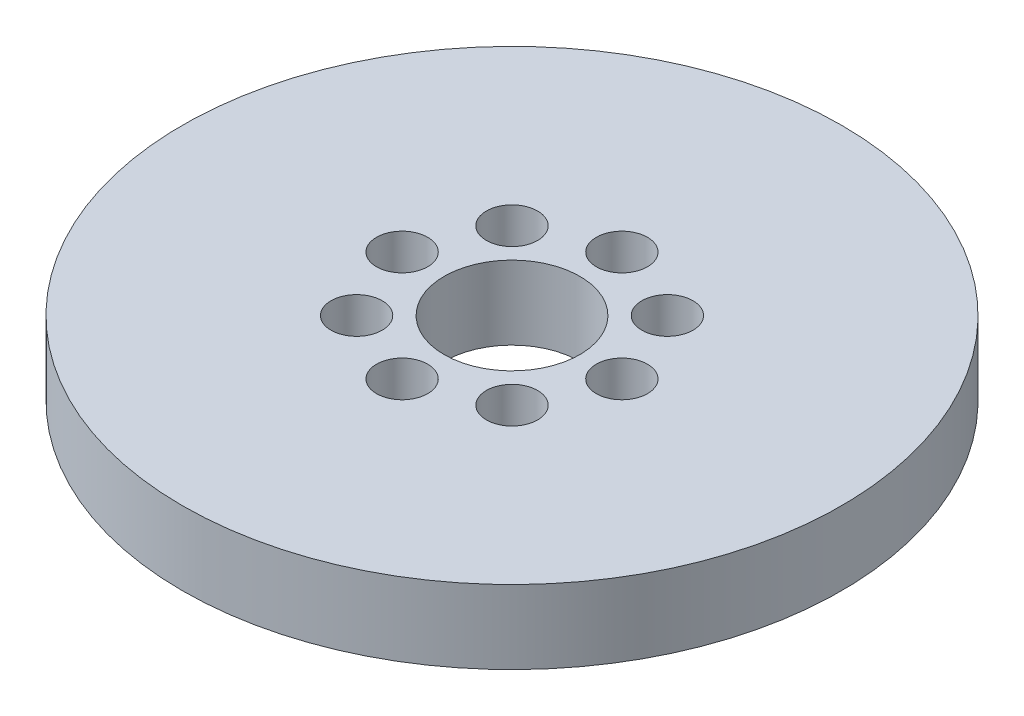
from build123d import *

# Parameters (mm, degrees)
SKETCH1_R           = 85
BOSS_EXTRUDE1_DEPTH = 19
SKETCH2_R           = 17.5
CUT_EXTRUDE1_DEPTH  = 122.70045193
SKETCH3_R           = 6.600383074
CUT_EXTRUDE2_DEPTH  = 12.705151312
CIRPATTERN1_COUNT   = 8


with BuildPart() as part:
    # Sketch1 → Boss-Extrude1 (new body)
    with BuildSketch(Plane(origin=(0, 0, 0), x_dir=(1, 0, 0), z_dir=(0, 1, 0))):
        Circle(SKETCH1_R)
    extrude(amount=BOSS_EXTRUDE1_DEPTH)

    # Sketch2 → Cut-Extrude1 (cut, through all)
    with BuildSketch(Plane(origin=(0, 0, 0), x_dir=(1, 0, 0), z_dir=(0, 1, 0))):
        Circle(SKETCH2_R)
    extrude(amount=CUT_EXTRUDE1_DEPTH, mode=Mode.SUBTRACT)

    # Sketch3 → Cut-Extrude2 (cut)
    with BuildSketch(Plane(origin=(0, 19, 0), x_dir=(1, 0, 0), z_dir=(0, 1, 0))):
        with Locations((-28.342478597, 0)):
            Circle(SKETCH3_R)
    cut_extrude2 = extrude(amount=-CUT_EXTRUDE2_DEPTH, mode=Mode.SUBTRACT)

    # CirPattern1: Cut-Extrude2 ×8 about axis
    cirpattern1_axis = Axis((0, 0, 0), (0, 1, 0))
    for i in range(1, CIRPATTERN1_COUNT):
        add(cut_extrude2.rotate(cirpattern1_axis, i * 360 / CIRPATTERN1_COUNT), mode=Mode.SUBTRACT)


solid = part.part
